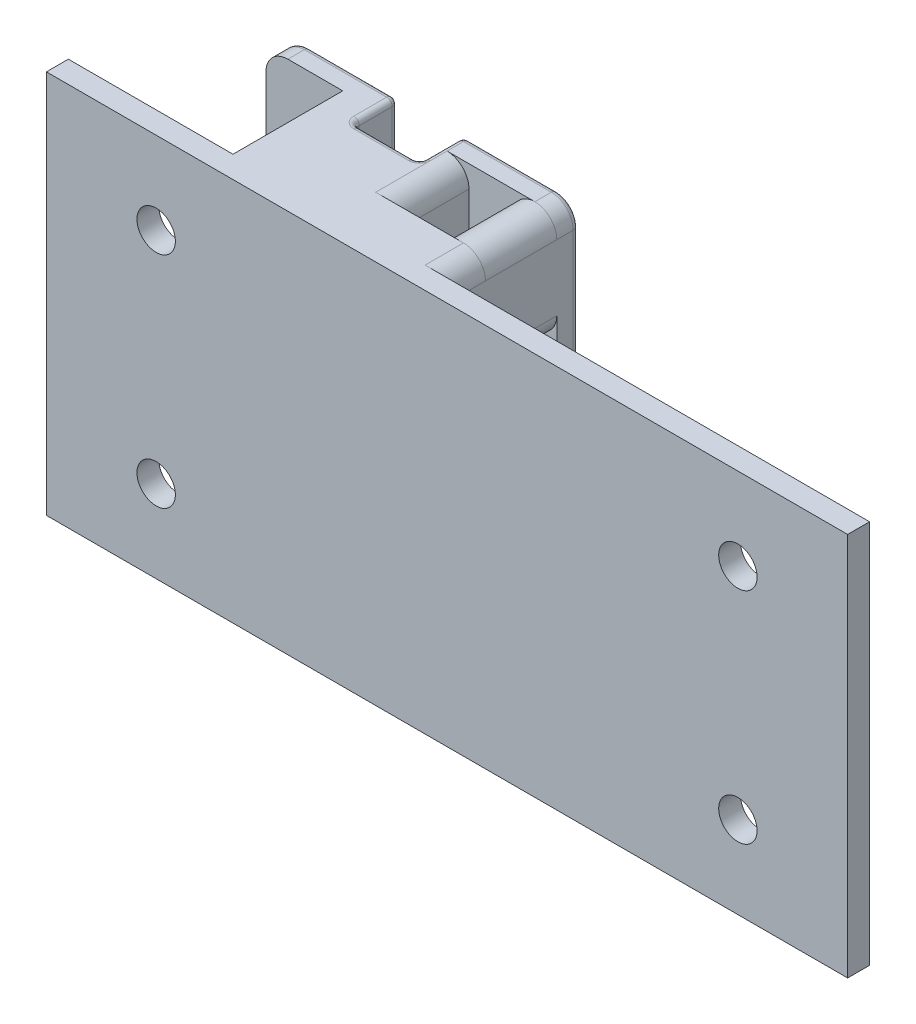
from build123d import *

# Parameters (mm, degrees)
ESQUISSE1_W             = 73
ESQUISSE1_H             = 35
ESQUISSE1_R             = 1.75
BOSS_EXTRU_1_DEPTH      = 2
BOSS_EXTRU_2_DEPTH      = 10
ESQUISSE3_W             = 26.5
ESQUISSE3_H             = 35
BOSS_EXTRU_3_DEPTH      = 2
ESQUISSE4_W             = 19.5
ESQUISSE4_H             = 35
BOSS_EXTRU_4_DEPTH      = 3.5
CONG_1_R                = 2
ESQUISSE5_W             = 6
ESQUISSE5_H             = 4
ENL_V_MAT_EXTRU_1_DEPTH = 35
CONG_2_R                = 0.5


with BuildPart() as part:
    # Esquisse1 → Boss.-Extru.1 (new body)
    with BuildSketch(Plane.XY):
        Rectangle(ESQUISSE1_W, ESQUISSE1_H)
        with Locations((-26.5, 10)):
            Circle(ESQUISSE1_R, mode=Mode.SUBTRACT)
        with Locations((-26.5, -10)):
            Circle(ESQUISSE1_R, mode=Mode.SUBTRACT)
        with Locations(Location((26.5, -10, 0), (0, 0, 180))):
            Circle(ESQUISSE1_R, mode=Mode.SUBTRACT)
        with Locations(Location((26.5, 10, 0), (0, 0, 180))):
            Circle(ESQUISSE1_R, mode=Mode.SUBTRACT)
    extrude(amount=-BOSS_EXTRU_1_DEPTH)

    # Esquisse2 → Boss.-Extru.2 (add)
    with BuildSketch(Plane(origin=(0, 0, -2), x_dir=(-1, 0, 0), z_dir=(0, 0, -1))):
        with BuildLine():
            Line((6, 15.5), (6, 9.5))
            ThreePointArc((6, 9.5), (4, 7.5), (2, 9.5))
            Line((2, 9.5), (2, 15.5))
            ThreePointArc((2, 15.5), (4, 17.5), (6, 15.5))
        make_face()
        with BuildLine():
            Line((6, -15.5), (6, -9.5))
            ThreePointArc((6, -9.5), (4, -7.5), (2, -9.5))
            Line((2, -9.5), (2, -15.5))
            ThreePointArc((2, -15.5), (4, -17.5), (6, -15.5))
        make_face()
        Polygon((10, 17.5), (10, 5.5), (2, 2.5), (2, -2.5), (10, -5.5), (10, -17.5), (21.5, -17.5), (21.5, 17.5), align=None)
    extrude(amount=BOSS_EXTRU_2_DEPTH)

    # Esquisse3 → Boss.-Extru.3 (add)
    with BuildSketch(Plane(origin=(0, 0, -12), x_dir=(-1, 0, 0), z_dir=(0, 0, -1))):
        with Locations((15.25, 0)):
            Rectangle(ESQUISSE3_W, ESQUISSE3_H)
    extrude(amount=BOSS_EXTRU_3_DEPTH)

    # Esquisse4 → Boss.-Extru.4 (add)
    with BuildSketch(Plane(origin=(0, 0, -2), x_dir=(-1, 0, 0), z_dir=(0, 0, -1))):
        with Locations((11.75, 0)):
            Rectangle(ESQUISSE4_W, ESQUISSE4_H)
    extrude(amount=BOSS_EXTRU_4_DEPTH)

    # Congé1
    cong_1_edges = [part.edges().sort_by_distance(p)[0] for p in [
        (-2, 17.5, -3.75),
        (-2, -17.5, -3.75),
        (-10, 17.5, -8.75),
        (-10, 5.5, -8.75),
        (-2, 2.5, -8.75),
        (-2, -2.5, -8.75),
        (-10, -5.5, -8.75),
        (-10, -17.5, -8.75),
        (-2, 17.5, -13),
        (-2, -17.5, -13),
        (-28.5, -17.5, -13),
        (-28.5, 17.5, -13),
    ]]
    fillet(cong_1_edges, radius=CONG_1_R - 0.0001)  # a hair under: the kernel refuses the full size

    # Esquisse5 → Enlèv. mat.-Extru.1 (cut)
    with BuildSketch(Plane(origin=(0, 17.5, 0), x_dir=(1, 0, 0), z_dir=(0, 1, 0))):
        with Locations((-15.5, 12)):
            Rectangle(ESQUISSE5_W, ESQUISSE5_H)
    extrude(amount=-ENL_V_MAT_EXTRU_1_DEPTH, mode=Mode.SUBTRACT)

    # Congé2
    cong_2_edges = [part.edges().sort_by_distance(p)[0] for p in [
        (-28.5, 0, -14),
        (-8.24995, -17.5, -14),
        (-2, 0, -14),
        (-22.50005, 17.5, -14),
        (-2.585757148, 16.914242852, -14),
        (-2.585757148, -16.914242852, -14),
        (-27.914242852, 16.914242852, -14),
        (-27.914242852, -16.914242852, -14),
        (-22.50005, -17.5, -14),
        (-8.24995, 17.5, -14),
        (-12.5, 17.5, -12),
        (-18.5, 17.5, -12),
        (-15.5, 17.5, -10),
        (-18.5, 0, -14),
        (-18.5, -17.5, -12),
        (-18.5, 0, -10),
        (-15.5, -17.5, -10),
        (-12.5, 0, -10),
        (-12.5, -17.5, -12),
        (-12.5, 0, -14),
    ]]
    fillet(cong_2_edges, radius=CONG_2_R)


solid = part.part
